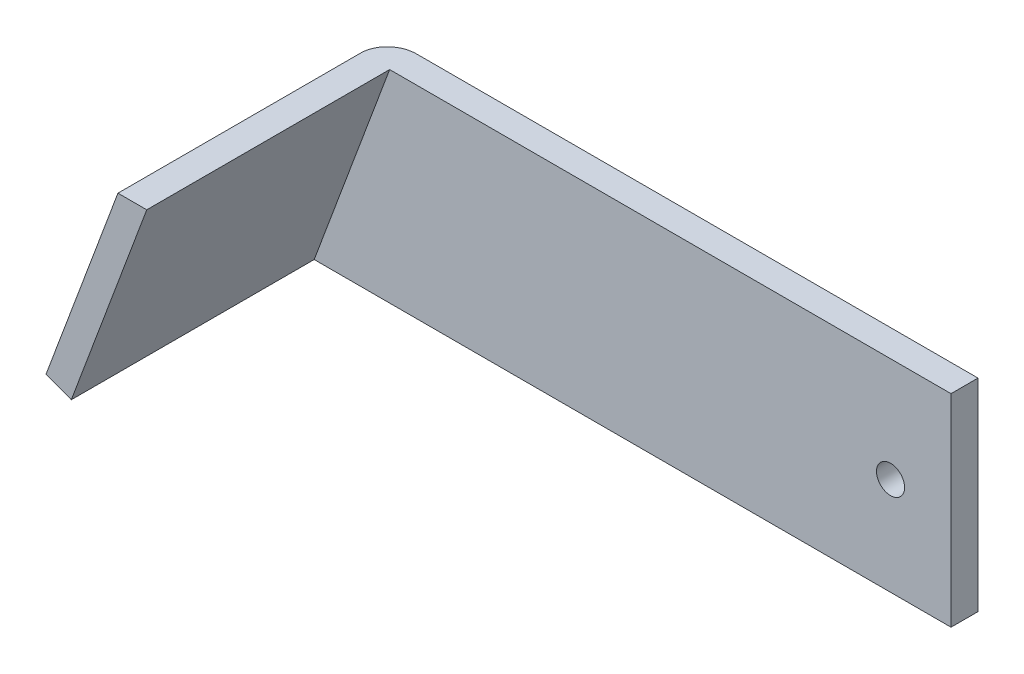
from build123d import *

# Parameters (mm, degrees)
SKETCH13_R              = 1.651
BASE_FLANGE5_DEPTH      = 3.175
EDGE_FLANGE4_START      = -48.484504913
EDGE_FLANGE4_DEPTH      = 25.4
CUT_EXTRUDE4_DEPTH      = 34.925
CUT_EXTRUDE4_DEPTH_BACK = 5.588


# Read off the part's stored shape, not the designer's step: Edge-Flange4
# Sheet-metal steps are written as plain solids
with BuildPart() as part:
    # Sketch13 → Base-Flange5 (new body)
    with BuildSketch(Plane.XY):
        Polygon((-66.04, 0), (0, 0), (0, -23.797677877), (-74.918655736, -23.797677877), align=None)
        with Locations((-7.112, -12.296727665)):
            Circle(SKETCH13_R, mode=Mode.SUBTRACT)
    extrude(amount=-BASE_FLANGE5_DEPTH)

    # Edge-Flange4 outline → Edge-Flange4 (add)
    with BuildSketch(Plane(origin=(0, 0, 0), x_dir=(0.9369164518419233, -0.34955337542060905, 0), z_dir=(0.34955337542060905, 0.9369164518419232, 0)).offset(EDGE_FLANGE4_START)):
        with BuildLine():
            Line((-61.87396248, -28.575), (-61.87396248, 3.175))
            ThreePointArc((-61.87396248, 3.175), (-64.11902651, 2.24506403), (-65.04896248, 0))
            Line((-65.04896248, 0), (-65.04896248, -28.575))
            Line((-65.04896248, -28.575), (-61.87396248, -28.575))
        make_face()
    extrude(amount=EDGE_FLANGE4_DEPTH)

    # Sketch51 → Cut-Extrude4 (cut, two sides: drawn at the far end of the back side and taken through both)
    with BuildSketch(Plane.XY.offset(-CUT_EXTRUDE4_DEPTH_BACK)):
        Polygon((-66.04, 0), (-69.428776015, 0), (-69.014709735, 1.109831967), align=None)
    extrude(amount=CUT_EXTRUDE4_DEPTH + CUT_EXTRUDE4_DEPTH_BACK, mode=Mode.SUBTRACT)


solid = part.part
